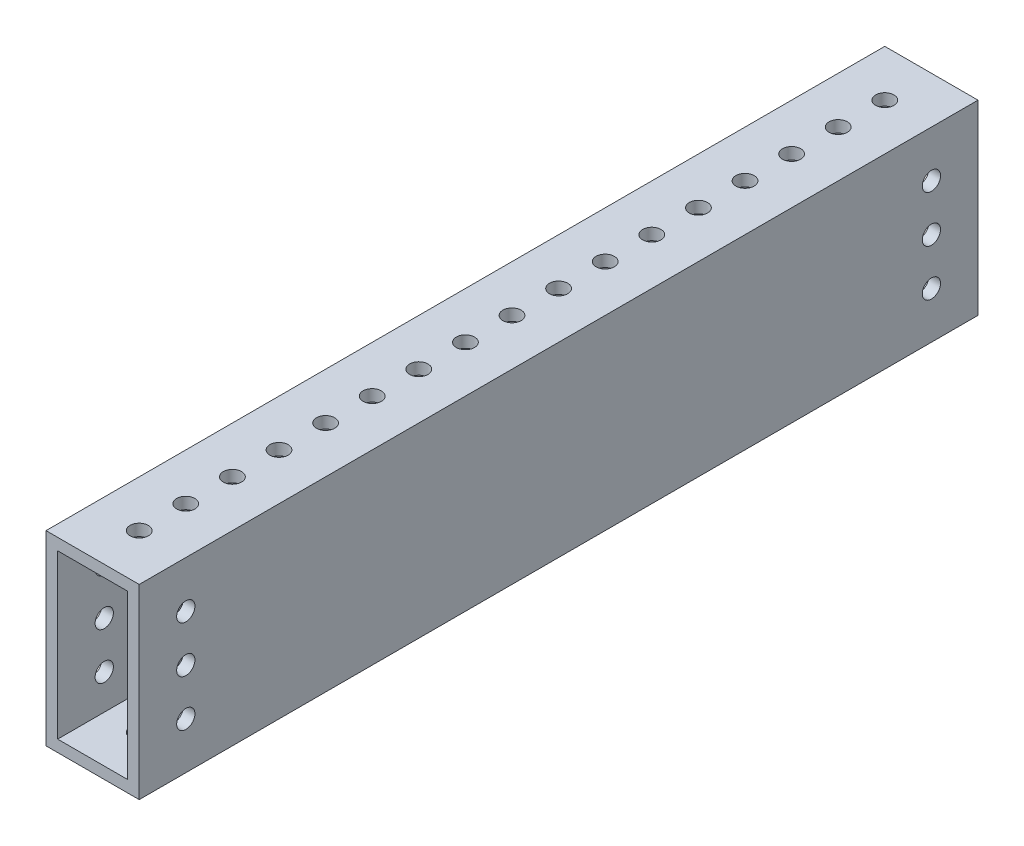
from build123d import *

# Parameters (mm, degrees)
SKETCH1_W           = 25.4
SKETCH1_H           = 50.8
SKETCH1_W_2         = 19.05
SKETCH1_H_2         = 44.45
BOSS_EXTRUDE1_DEPTH = 114.3
SKETCH2_R           = 2.4892
CUT_EXTRUDE1_DEPTH  = 126.723585695
SKETCH3_R           = 2.4892
CUT_EXTRUDE2_DEPTH  = 120.811560377


with BuildPart() as part:
    # Sketch1 → Boss-Extrude1 (new, symmetric)
    with BuildSketch(Plane.XY):
        Rectangle(SKETCH1_W, SKETCH1_H)
        Rectangle(SKETCH1_W_2, SKETCH1_H_2, mode=Mode.SUBTRACT)
    extrude(amount=BOSS_EXTRUDE1_DEPTH, both=True)

    # Sketch2 → Cut-Extrude1 (cut, through all)
    with BuildSketch(Plane(origin=(0, 25.4, 0), x_dir=(1, 0, 0), z_dir=(0, 1, 0))):
        with Locations((0, -101.6)):
            Circle(SKETCH2_R)
        with Locations((0, -88.9)):
            Circle(SKETCH2_R)
        with Locations((0, -76.2)):
            Circle(SKETCH2_R)
        with Locations((0, -63.5)):
            Circle(SKETCH2_R)
        with Locations((0, -50.8)):
            Circle(SKETCH2_R)
        with Locations((0, -38.1)):
            Circle(SKETCH2_R)
        with Locations((0, -25.4)):
            Circle(SKETCH2_R)
        with Locations((0, -12.7)):
            Circle(SKETCH2_R)
        Circle(SKETCH2_R)
        with Locations((0, 12.7)):
            Circle(SKETCH2_R)
        with Locations((0, 25.4)):
            Circle(SKETCH2_R)
        with Locations((0, 38.1)):
            Circle(SKETCH2_R)
        with Locations((0, 50.8)):
            Circle(SKETCH2_R)
        with Locations((0, 63.5)):
            Circle(SKETCH2_R)
        with Locations((0, 76.2)):
            Circle(SKETCH2_R)
        with Locations((0, 88.9)):
            Circle(SKETCH2_R)
        with Locations((0, 101.6)):
            Circle(SKETCH2_R)
    extrude(amount=-CUT_EXTRUDE1_DEPTH, mode=Mode.SUBTRACT)

    # Sketch3 → Cut-Extrude2 (cut, through all)
    with BuildSketch(Plane.ZY.offset(12.7)):
        with Locations((101.6, 0)):
            Circle(SKETCH3_R)
        with Locations((101.6, -12.7)):
            Circle(SKETCH3_R)
        with Locations((101.6, 12.7)):
            Circle(SKETCH3_R)
    cut_extrude2 = extrude(amount=-CUT_EXTRUDE2_DEPTH, mode=Mode.SUBTRACT)

    # Mirror1: Cut-Extrude2 across plane
    add(cut_extrude2.mirror(Plane.XY), mode=Mode.SUBTRACT)


solid = part.part
